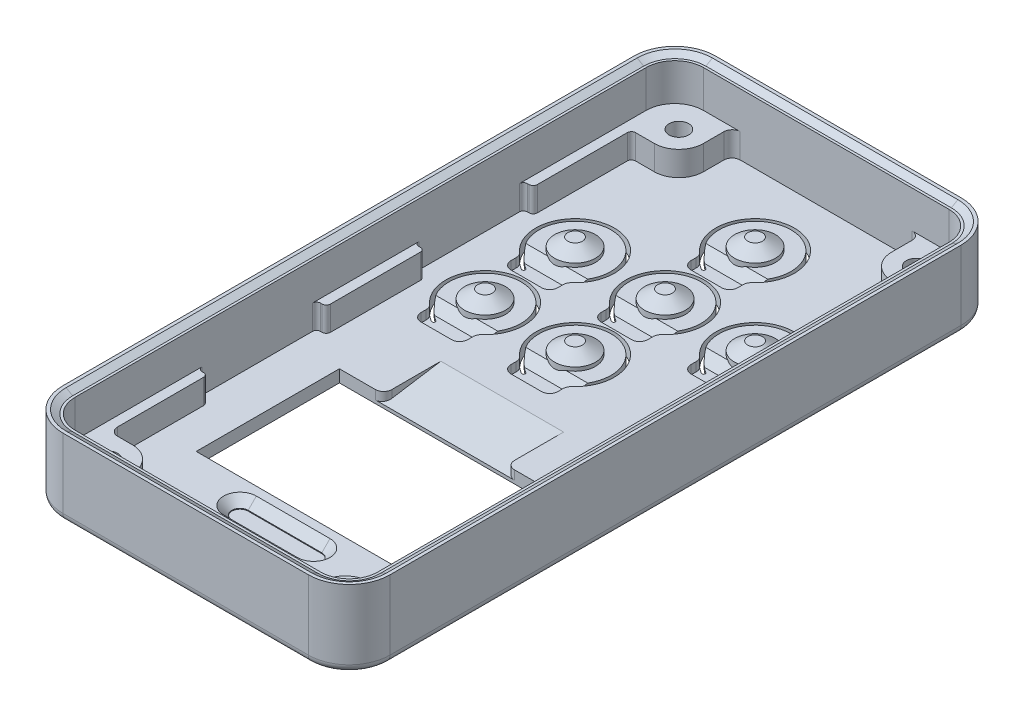
from build123d import *

# Parameters (mm, degrees)
BASE_SKETCH_W                             = 40
BASE_SKETCH_H                             = 79.79
BASE_DEPTH                                = 9.5
CORNER_ROUNDS_R5_R                        = 5
SHELL_1_5_T                               = -1.5
BOSS_SKETCH_R                             = 1
CORNER_BOSSES_STOP_AT_LEDGE_Y4_5_M2_DEPTH = 4.5
LEDGE_SKETCH_W                            = 1.2
LEDGE_SKETCH_H                            = 12
SIDE_LEDGES_DEPTH                         = 4.5
OUTER_FACE_ROUND_R1_R                     = 1
WINDOW_SKETCH_W                           = 25.8
WINDOW_SKETCH_H                           = 17.2
DISPLAY_WINDOW_DEPTH                      = 90.759089233
CABLE_RAMP_DEPTH                          = 7.5
CABLE_RAMP_DEPTH_BACK                     = 7.5
LED_WINDOW_SKETCH_R                       = 1.7
LED_WINDOW_DEPTH                          = 1.1
PLUNGER_STEMS_SKETCH_R                    = 2.5
PLUNGER_STEMS_5_0_DEPTH                   = 0.45
PLUNGER_CONE_SKETCH_R                     = 2.5
PLUNGER_CONES_TO_1_8_DEPTH                = 1
PLUNGER_CONES_TO_1_8_DRAFT                = 57.994616792
PLUNGER_CONES_TO_1_8_PROFILE_2_DEPTH      = 1
PLUNGER_CONES_TO_1_8_PROFILE_2_DRAFT      = 57.994616792
PLUNGER_CONES_TO_1_8_PROFILE_3_DEPTH      = 1
PLUNGER_CONES_TO_1_8_PROFILE_3_DRAFT      = 57.994616792
PLUNGER_CONES_TO_1_8_PROFILE_4_DEPTH      = 1
PLUNGER_CONES_TO_1_8_PROFILE_4_DRAFT      = 57.994616792
PLUNGER_CONES_TO_1_8_PROFILE_5_DEPTH      = 1
PLUNGER_CONES_TO_1_8_PROFILE_5_DRAFT      = 57.994616792
PLUNGER_CONES_TO_1_8_PROFILE_6_DEPTH      = 1
PLUNGER_CONES_TO_1_8_PROFILE_6_DRAFT      = 57.994616792
BOSS_JUNCTION_FILLETS_R1_R                = 1
SKETCH10_W                                = 5.728
SKETCH10_H                                = 2.623
CUT_EXTRUDE7_DEPTH                        = 1.1
BUTTON_C_SLOTS_300DEG_0_4_DEPTH           = 90.759089233
CHAMFER1_SIZE                             = 1.1
FILLET1_R                                 = 1
FILLET2_R                                 = 0.5
FILLET3_R                                 = 1
SKETCH14_R                                = 3.1
SKETCH14_R_2                              = 1.9
BUTTON_SYMBOL_RECESS_0_4_DEPTH            = 0.4
SKETCH15_R                                = 3.1
SKETCH15_R_2                              = 1.9
BUTTON_SYMBOL_INLAYS_0_4_COLOUR_2_DEPTH   = 0.4
BUTTON_SYMBOL_INLAYS_0_4_COLOUR_2_2_DEPTH = 0.4
BUTTON_SYMBOL_INLAYS_0_4_COLOUR_2_3_DEPTH = 0.4
BUTTON_SYMBOL_INLAYS_0_4_COLOUR_2_4_DEPTH = 0.4
BUTTON_SYMBOL_INLAYS_0_4_COLOUR_2_5_DEPTH = 0.4
BUTTON_SYMBOL_INLAYS_0_4_COLOUR_2_6_DEPTH = 0.4
BUTTON_SYMBOL_INLAYS_0_4_COLOUR_2_7_DEPTH = 0.4
SKETCH18_W                                = 25.8
SKETCH18_H                                = 1.5
CUT_EXTRUDE16_DEPTH                       = 0.3
I2C_HEADER_LEAD_POCKET_2_0_0_2_SKIN_DEPTH = 1.1
CHAMFER3_SIZE                             = 1
SKETCH21_R                                = 2.6
SKETCH21_R_2                              = 2.5
CUT_EXTRUDE17_DEPTH                       = 0.1
M2_CLEARANCE_2_4_SCREW_FROM_FRONT_SKET_R  = 1.2
M2_CLEARANCE_2_4_SCREW_FROM_FRONT_DEPTH   = 90.759089233
M2_HEAD_COUNTERBORE_4_4_X_2_0_SKETCH_R    = 2.2
M2_HEAD_COUNTERBORE_4_4_X_2_0_DEPTH       = 2
M2_CSK_SEATS_HEAD_1_MM_BELOW_FACE_SIZE    = 1
WALL_BEVEL_30DEG_0_4_FLATS_DEPTH          = 0.461880215
WALL_BEVEL_30DEG_0_4_FLATS_DRAFT          = -60


# Some blends are built 0.0001 mm under size
with BuildPart() as part:
    # Base Sketch → Base (new body)
    with BuildSketch(Plane(origin=(0, 0, 0), x_dir=(1, 0, 0), z_dir=(0, 1, 0))):
        with Locations((20, 39.895)):
            Rectangle(BASE_SKETCH_W, BASE_SKETCH_H)
    extrude(amount=BASE_DEPTH)

    # Corner Rounds R5
    corner_rounds_r5_edges = [part.edges().sort_by_distance(p)[0] for p in [
        (0, 4.75, -79.79),
        (40, 4.75, -79.79),
        (40, 4.75, 0),
        (0, 4.75, 0),
    ]]
    fillet(corner_rounds_r5_edges, radius=CORNER_ROUNDS_R5_R)

    # Shell 1.5
    shell_1_5_openings = [part.faces().sort_by_distance(p)[0] for p in [
        (20, 9.5, -39.895),
    ]]
    offset(amount=SHELL_1_5_T, openings=shell_1_5_openings, kind=Kind.INTERSECTION)

    # Boss Sketch → Corner Bosses (stop at ledge y4.5) + M2 Holes (add)
    # profile 1 of 4: a face of its own
    with BuildSketch(Plane(origin=(0, 0, 0), x_dir=(1, 0, 0), z_dir=(0, 1, 0))):
        with BuildLine():
            Line((1.5, 1.5), (8.5, 1.5))
            Line((8.5, 1.5), (8.5, 5))
            ThreePointArc((8.5, 5), (7.6213, 7.1213), (5.5, 8))
            Line((5.5, 8), (1.5, 8))
            Line((1.5, 8), (1.5, 1.5))
        make_face()
        with Locations(Location((5.5, 5, 0), (0, 0, 270))):
            Circle(BOSS_SKETCH_R, mode=Mode.SUBTRACT)
    # profile 2 of 4: a face of its own
    with BuildSketch(Plane(origin=(0, 0, 0), x_dir=(1, 0, 0), z_dir=(0, 1, 0))):
        with BuildLine():
            Line((38.5, 1.5), (31.5, 1.5))
            Line((31.5, 1.5), (31.5, 5))
            ThreePointArc((31.5, 5), (32.3787, 7.1213), (34.5, 8))
            Line((34.5, 8), (38.5, 8))
            Line((38.5, 8), (38.5, 1.5))
        make_face()
        with Locations(Location((34.5, 5, 0), (0, 0, 270))):
            Circle(BOSS_SKETCH_R, mode=Mode.SUBTRACT)
    # profile 3 of 4: a face of its own
    with BuildSketch(Plane(origin=(0, 0, 0), x_dir=(1, 0, 0), z_dir=(0, 1, 0))):
        with BuildLine():
            Line((1.5, 78.29), (8.5, 78.29))
            Line((8.5, 78.29), (8.5, 74.79))
            ThreePointArc((8.5, 74.79), (7.6213, 72.6687), (5.5, 71.79))
            Line((5.5, 71.79), (1.5, 71.79))
            Line((1.5, 71.79), (1.5, 78.29))
        make_face()
        with Locations(Location((5.5, 74.79, 0), (0, 0, 270))):
            Circle(BOSS_SKETCH_R, mode=Mode.SUBTRACT)
    # profile 4 of 4: a face of its own
    with BuildSketch(Plane(origin=(0, 0, 0), x_dir=(1, 0, 0), z_dir=(0, 1, 0))):
        with BuildLine():
            Line((38.5, 78.29), (31.5, 78.29))
            Line((31.5, 78.29), (31.5, 74.79))
            ThreePointArc((31.5, 74.79), (32.3787, 72.6687), (34.5, 71.79))
            Line((34.5, 71.79), (38.5, 71.79))
            Line((38.5, 71.79), (38.5, 78.29))
        make_face()
        with Locations(Location((34.5, 74.79, 0), (0, 0, 270))):
            Circle(BOSS_SKETCH_R, mode=Mode.SUBTRACT)
    extrude(amount=CORNER_BOSSES_STOP_AT_LEDGE_Y4_5_M2_DEPTH)

    # Ledge Sketch → Side Ledges (add)
    with BuildSketch(Plane(origin=(0, 0, 0), x_dir=(1, 0, 0), z_dir=(0, 1, 0))):
        with Locations((2.1, 14)):
            Rectangle(LEDGE_SKETCH_W, LEDGE_SKETCH_H)
        with Locations((37.9, 14)):
            Rectangle(LEDGE_SKETCH_W, LEDGE_SKETCH_H)
        with Locations((2.1, 40.5)):
            Rectangle(LEDGE_SKETCH_W, LEDGE_SKETCH_H)
        with Locations((37.9, 40.5)):
            Rectangle(LEDGE_SKETCH_W, LEDGE_SKETCH_H)
        with Locations((2.1, 65.79)):
            Rectangle(LEDGE_SKETCH_W, LEDGE_SKETCH_H)
        with Locations((37.9, 65.79)):
            Rectangle(LEDGE_SKETCH_W, LEDGE_SKETCH_H)
    extrude(amount=SIDE_LEDGES_DEPTH)

    # Outer Face Round R1
    outer_face_round_r1_edges = [part.edges().sort_by_distance(p)[0] for p in [
        (0, 0, -39.895),
        (20, 0, -79.79),
        (40, 0, -39.895),
        (20, 0, 0),
        (1.464466094, 0, -1.464466094),
        (38.535533906, 0, -1.464466094),
        (38.535533906, 0, -78.325533906),
        (1.464466094, 0, -78.325533906),
    ]]
    fillet(outer_face_round_r1_edges, radius=OUTER_FACE_ROUND_R1_R)

    # Window Sketch → Display Window (cut, through all)
    with BuildSketch(Plane(origin=(0, 0, 0), x_dir=(1, 0, 0), z_dir=(0, 1, 0))):
        with Locations((20, 23.1)):
            Rectangle(WINDOW_SKETCH_W, WINDOW_SKETCH_H)
    extrude(amount=DISPLAY_WINDOW_DEPTH, mode=Mode.SUBTRACT)

    # Ramp Sketch → Cable Ramp (cut, two sides: drawn at the far end of the back side and taken through both)
    with BuildSketch(Plane(origin=(20, 0, 0), x_dir=(0, 0, -1), z_dir=(1, 0, 0)).offset(-CABLE_RAMP_DEPTH_BACK)):
        Polygon((31, 0.4), (31.7, 0.4), (38.7, 1.5), (38.7, 2.5), (31, 2.5), align=None)
    extrude(amount=CABLE_RAMP_DEPTH + CABLE_RAMP_DEPTH_BACK, mode=Mode.SUBTRACT)

    # LED Window Sketch → LED Window (cut)
    with BuildSketch(Plane(origin=(0, 1.5, 0), x_dir=(1, 0, 0), z_dir=(0, 1, 0))):
        with Locations(Location((20, 7.28, 0), (0, 0, 270))):
            Circle(LED_WINDOW_SKETCH_R)
    extrude(amount=-LED_WINDOW_DEPTH, mode=Mode.SUBTRACT)

    # Plunger Stems Sketch → Plunger Stems 5.0 (add)
    with BuildSketch(Plane(origin=(0, 1.5, 0), x_dir=(1, 0, 0), z_dir=(0, 1, 0))):
        with Locations(Location((9, 47.6, 0), (0, 0, 270))):
            Circle(PLUNGER_STEMS_SKETCH_R)
        with Locations(Location((20, 47.6, 0), (0, 0, 270))):
            Circle(PLUNGER_STEMS_SKETCH_R)
        with Locations(Location((9, 58.6, 0), (0, 0, 270))):
            Circle(PLUNGER_STEMS_SKETCH_R)
        with Locations(Location((20, 58.6, 0), (0, 0, 270))):
            Circle(PLUNGER_STEMS_SKETCH_R)
        with Locations(Location((31, 58.6, 0), (0, 0, 270))):
            Circle(PLUNGER_STEMS_SKETCH_R)
        with Locations(Location((20, 69.6, 0), (0, 0, 270))):
            Circle(PLUNGER_STEMS_SKETCH_R)
    extrude(amount=PLUNGER_STEMS_5_0_DEPTH)


with BuildPart() as plunger_cones_to_1_8_tool:
    # Plunger Cone Sketch → Plunger Cones to 1.8 (with draft: the straight prism first)
    with BuildSketch(Plane(origin=(0, 1.95, 0), x_dir=(1, 0, 0), z_dir=(0, 1, 0))):
        with Locations(Location((9, 47.6, 0), (0, 0, 270))):
            Circle(PLUNGER_CONE_SKETCH_R)
    extrude(amount=PLUNGER_CONES_TO_1_8_DEPTH)
    # Plunger Cones to 1.8: the draft: its side faces are tilted about the plane it starts from
    plunger_cones_to_1_8_sides = [plunger_cones_to_1_8_tool.faces().sort_by_distance(p)[0] for p in [
        (9, 2.45, -50.1),
    ]]
    draft(plunger_cones_to_1_8_sides, Plane(origin=(0, 1.95, 0), x_dir=(1, 0, 0), z_dir=(0, 1, 0)), PLUNGER_CONES_TO_1_8_DRAFT)


with BuildPart() as part_1:
    add(part.part)

    # Plunger Cones to 1.8: add plunger_cones_to_1_8_tool
    add(plunger_cones_to_1_8_tool.part)


with BuildPart() as plunger_cones_to_1_8_profile_2_tool:
    # Plunger Cone Sketch → Plunger Cones to 1.8 profile 2 (with draft: the straight prism first)
    with BuildSketch(Plane(origin=(0, 1.95, 0), x_dir=(1, 0, 0), z_dir=(0, 1, 0))):
        with Locations(Location((20, 47.6, 0), (0, 0, 270))):
            Circle(PLUNGER_CONE_SKETCH_R)
    extrude(amount=PLUNGER_CONES_TO_1_8_PROFILE_2_DEPTH)
    # Plunger Cones to 1.8 profile 2: the draft: its side faces are tilted about the plane it starts from
    plunger_cones_to_1_8_profile_2_sides = [plunger_cones_to_1_8_profile_2_tool.faces().sort_by_distance(p)[0] for p in [
        (20, 2.45, -50.1),
    ]]
    draft(plunger_cones_to_1_8_profile_2_sides, Plane(origin=(0, 1.95, 0), x_dir=(1, 0, 0), z_dir=(0, 1, 0)), PLUNGER_CONES_TO_1_8_PROFILE_2_DRAFT)


with BuildPart() as part_2:
    add(part_1.part)

    # Plunger Cones to 1.8 profile 2: add plunger_cones_to_1_8_profile_2_tool
    add(plunger_cones_to_1_8_profile_2_tool.part)


with BuildPart() as plunger_cones_to_1_8_profile_3_tool:
    # Plunger Cone Sketch → Plunger Cones to 1.8 profile 3 (with draft: the straight prism first)
    with BuildSketch(Plane(origin=(0, 1.95, 0), x_dir=(1, 0, 0), z_dir=(0, 1, 0))):
        with Locations(Location((9, 58.6, 0), (0, 0, 270))):
            Circle(PLUNGER_CONE_SKETCH_R)
    extrude(amount=PLUNGER_CONES_TO_1_8_PROFILE_3_DEPTH)
    # Plunger Cones to 1.8 profile 3: the draft: its side faces are tilted about the plane it starts from
    plunger_cones_to_1_8_profile_3_sides = [plunger_cones_to_1_8_profile_3_tool.faces().sort_by_distance(p)[0] for p in [
        (9, 2.45, -61.1),
    ]]
    draft(plunger_cones_to_1_8_profile_3_sides, Plane(origin=(0, 1.95, 0), x_dir=(1, 0, 0), z_dir=(0, 1, 0)), PLUNGER_CONES_TO_1_8_PROFILE_3_DRAFT)


with BuildPart() as part_3:
    add(part_2.part)

    # Plunger Cones to 1.8 profile 3: add plunger_cones_to_1_8_profile_3_tool
    add(plunger_cones_to_1_8_profile_3_tool.part)


with BuildPart() as plunger_cones_to_1_8_profile_4_tool:
    # Plunger Cone Sketch → Plunger Cones to 1.8 profile 4 (with draft: the straight prism first)
    with BuildSketch(Plane(origin=(0, 1.95, 0), x_dir=(1, 0, 0), z_dir=(0, 1, 0))):
        with Locations(Location((20, 58.6, 0), (0, 0, 270))):
            Circle(PLUNGER_CONE_SKETCH_R)
    extrude(amount=PLUNGER_CONES_TO_1_8_PROFILE_4_DEPTH)
    # Plunger Cones to 1.8 profile 4: the draft: its side faces are tilted about the plane it starts from
    plunger_cones_to_1_8_profile_4_sides = [plunger_cones_to_1_8_profile_4_tool.faces().sort_by_distance(p)[0] for p in [
        (20, 2.45, -61.1),
    ]]
    draft(plunger_cones_to_1_8_profile_4_sides, Plane(origin=(0, 1.95, 0), x_dir=(1, 0, 0), z_dir=(0, 1, 0)), PLUNGER_CONES_TO_1_8_PROFILE_4_DRAFT)


with BuildPart() as part_4:
    add(part_3.part)

    # Plunger Cones to 1.8 profile 4: add plunger_cones_to_1_8_profile_4_tool
    add(plunger_cones_to_1_8_profile_4_tool.part)


with BuildPart() as plunger_cones_to_1_8_profile_5_tool:
    # Plunger Cone Sketch → Plunger Cones to 1.8 profile 5 (with draft: the straight prism first)
    with BuildSketch(Plane(origin=(0, 1.95, 0), x_dir=(1, 0, 0), z_dir=(0, 1, 0))):
        with Locations(Location((31, 58.6, 0), (0, 0, 270))):
            Circle(PLUNGER_CONE_SKETCH_R)
    extrude(amount=PLUNGER_CONES_TO_1_8_PROFILE_5_DEPTH)
    # Plunger Cones to 1.8 profile 5: the draft: its side faces are tilted about the plane it starts from
    plunger_cones_to_1_8_profile_5_sides = [plunger_cones_to_1_8_profile_5_tool.faces().sort_by_distance(p)[0] for p in [
        (31, 2.45, -61.1),
    ]]
    draft(plunger_cones_to_1_8_profile_5_sides, Plane(origin=(0, 1.95, 0), x_dir=(1, 0, 0), z_dir=(0, 1, 0)), PLUNGER_CONES_TO_1_8_PROFILE_5_DRAFT)


with BuildPart() as part_5:
    add(part_4.part)

    # Plunger Cones to 1.8 profile 5: add plunger_cones_to_1_8_profile_5_tool
    add(plunger_cones_to_1_8_profile_5_tool.part)


with BuildPart() as plunger_cones_to_1_8_profile_6_tool:
    # Plunger Cone Sketch → Plunger Cones to 1.8 profile 6 (with draft: the straight prism first)
    with BuildSketch(Plane(origin=(0, 1.95, 0), x_dir=(1, 0, 0), z_dir=(0, 1, 0))):
        with Locations(Location((20, 69.6, 0), (0, 0, 270))):
            Circle(PLUNGER_CONE_SKETCH_R)
    extrude(amount=PLUNGER_CONES_TO_1_8_PROFILE_6_DEPTH)
    # Plunger Cones to 1.8 profile 6: the draft: its side faces are tilted about the plane it starts from
    plunger_cones_to_1_8_profile_6_sides = [plunger_cones_to_1_8_profile_6_tool.faces().sort_by_distance(p)[0] for p in [
        (20, 2.45, -72.1),
    ]]
    draft(plunger_cones_to_1_8_profile_6_sides, Plane(origin=(0, 1.95, 0), x_dir=(1, 0, 0), z_dir=(0, 1, 0)), PLUNGER_CONES_TO_1_8_PROFILE_6_DRAFT)


with BuildPart() as part_6:
    add(part_5.part)

    # Plunger Cones to 1.8 profile 6: add plunger_cones_to_1_8_profile_6_tool
    add(plunger_cones_to_1_8_profile_6_tool.part)

    # Boss Junction Fillets R1
    boss_junction_fillets_r1_edges = [part_6.edges().sort_by_distance(p)[0] for p in [
        (31.5, 3, -1.5),
        (8.5, 3, -78.29),
        (31.5, 3, -78.29),
        (8.5, 3, -1.5),
        (37.3, 3, -8),
        (37.3, 3, -71.79),
        (2.7, 3, -8),
    ]]
    fillet(boss_junction_fillets_r1_edges, radius=BOSS_JUNCTION_FILLETS_R1_R)

    # Sketch10 → Cut-Extrude7 (cut)
    with BuildSketch(Plane(origin=(0, 1.5, 0), x_dir=(1, 0, 0), z_dir=(0, 1, 0))):
        with Locations((9, 42.9475)):
            Rectangle(SKETCH10_W, SKETCH10_H)
        with Locations((20, 42.9475)):
            Rectangle(SKETCH10_W, SKETCH10_H)
        with Locations((9, 53.9475)):
            Rectangle(SKETCH10_W, SKETCH10_H)
        with Locations((20, 53.9475)):
            Rectangle(SKETCH10_W, SKETCH10_H)
        with Locations((31, 53.9475)):
            Rectangle(SKETCH10_W, SKETCH10_H)
        with Locations((20, 64.9475)):
            Rectangle(SKETCH10_W, SKETCH10_H)
    extrude(amount=-CUT_EXTRUDE7_DEPTH, mode=Mode.SUBTRACT)

    # Sketch11 → Button C-Slots 300deg 0.4 (cut, through all)
    with BuildSketch(Plane(origin=(0, 0, 0), x_dir=(1, 0, 0), z_dir=(0, 1, 0))):
        with BuildLine():
            ThreePointArc((11.4, 43.443078062), (9, 52.4), (6.6, 43.443078062))
            ThreePointArc((6.6, 43.443078062), (6.873205081, 43.516283143), (6.8, 43.789488223))
            ThreePointArc((6.8, 43.789488223), (9, 52), (11.2, 43.789488223))
            ThreePointArc((11.2, 43.789488223), (11.126794919, 43.516283143), (11.4, 43.443078062))
        make_face()
        with BuildLine():
            ThreePointArc((22.4, 43.443078062), (20, 52.4), (17.6, 43.443078062))
            ThreePointArc((17.6, 43.443078062), (17.873205081, 43.516283143), (17.8, 43.789488223))
            ThreePointArc((17.8, 43.789488223), (20, 52), (22.2, 43.789488223))
            ThreePointArc((22.2, 43.789488223), (22.126794919, 43.516283143), (22.4, 43.443078062))
        make_face()
        with BuildLine():
            ThreePointArc((11.4, 54.443078062), (9, 63.4), (6.6, 54.443078062))
            ThreePointArc((6.6, 54.443078062), (6.873205081, 54.516283143), (6.8, 54.789488223))
            ThreePointArc((6.8, 54.789488223), (9, 63), (11.2, 54.789488223))
            ThreePointArc((11.2, 54.789488223), (11.126794919, 54.516283143), (11.4, 54.443078062))
        make_face()
        with BuildLine():
            ThreePointArc((22.4, 54.443078062), (20, 63.4), (17.6, 54.443078062))
            ThreePointArc((17.6, 54.443078062), (17.873205081, 54.516283143), (17.8, 54.789488223))
            ThreePointArc((17.8, 54.789488223), (20, 63), (22.2, 54.789488223))
            ThreePointArc((22.2, 54.789488223), (22.126794919, 54.516283143), (22.4, 54.443078062))
        make_face()
        with BuildLine():
            ThreePointArc((33.4, 54.443078062), (31, 63.4), (28.6, 54.443078062))
            ThreePointArc((28.6, 54.443078062), (28.873205081, 54.516283143), (28.8, 54.789488223))
            ThreePointArc((28.8, 54.789488223), (31, 63), (33.2, 54.789488223))
            ThreePointArc((33.2, 54.789488223), (33.126794919, 54.516283143), (33.4, 54.443078062))
        make_face()
        with BuildLine():
            ThreePointArc((22.4, 65.443078062), (20, 74.4), (17.6, 65.443078062))
            ThreePointArc((17.6, 65.443078062), (17.873205081, 65.516283143), (17.8, 65.789488223))
            ThreePointArc((17.8, 65.789488223), (20, 74), (22.2, 65.789488223))
            ThreePointArc((22.2, 65.789488223), (22.126794919, 65.516283143), (22.4, 65.443078062))
        make_face()
    extrude(amount=BUTTON_C_SLOTS_300DEG_0_4_DEPTH, mode=Mode.SUBTRACT)

    # Chamfer1
    # the kernel refuses this chamfer: 1.1 mm, written as the material it takes off along each edge
    with BuildSketch(Plane(origin=(3.307982808, 1.5, -44.259), x_dir=(0, -0.9996219169112969, 0.02749587661058343), z_dir=(1, 0, 0))) as chamfer1_piece_1_section:
        Polygon((CHAMFER1_SIZE * 0.999621916911, CHAMFER1_SIZE * 0.0274958766106), (-CHAMFER1_SIZE * 0.0274958766106, CHAMFER1_SIZE * 0.999621916911), (0, 0), align=None)
    chamfer1_piece_1 = extrude(amount=11.384034384, mode=Mode.PRIVATE)
    chamfer1_piece_1 = chamfer1_piece_1 & Plane(origin=(9, 1.139629686, -47.6), x_dir=(-0.5000000000000002, 0, 0.8660254037844386), z_dir=(0, -1, 0)) * Cylinder(4.4, 28, mode=Mode.PRIVATE)
    chamfer1_piece_1 = chamfer1_piece_1 - Plane(origin=(9, 1.139629686, -47.6), x_dir=(0, 0, 1), z_dir=(0, -1, 0)) * Cylinder(2.5, 28, mode=Mode.PRIVATE)
    add(chamfer1_piece_1, mode=Mode.SUBTRACT)
    with BuildSketch(Plane(origin=(14.307982808, 1.5, -66.259), x_dir=(0, -0.9996219169112966, 0.0274958766105897), z_dir=(1, 0, 0))) as chamfer1_piece_2_section:
        Polygon((CHAMFER1_SIZE * 0.999621916911, CHAMFER1_SIZE * 0.0274958766106), (-CHAMFER1_SIZE * 0.0274958766106, CHAMFER1_SIZE * 0.999621916911), (0, 0), align=None)
    chamfer1_piece_2 = extrude(amount=11.384034384, mode=Mode.PRIVATE)
    chamfer1_piece_2 = chamfer1_piece_2 & Plane(origin=(20, 1.139629686, -69.6), x_dir=(-0.5000000000000007, 0, 0.8660254037844384), z_dir=(0, -1, 0)) * Cylinder(4.4, 28, mode=Mode.PRIVATE)
    chamfer1_piece_2 = chamfer1_piece_2 - Plane(origin=(20, 1.139629686, -69.6), x_dir=(0, 0, 1), z_dir=(0, -1, 0)) * Cylinder(2.5, 28, mode=Mode.PRIVATE)
    add(chamfer1_piece_2, mode=Mode.SUBTRACT)
    with BuildSketch(Plane(origin=(25.307982808, 1.5, -55.259), x_dir=(0, -0.9996219169112969, 0.02749587661058343), z_dir=(1, 0, 0))) as chamfer1_piece_3_section:
        Polygon((CHAMFER1_SIZE * 0.999621916911, CHAMFER1_SIZE * 0.0274958766106), (-CHAMFER1_SIZE * 0.0274958766106, CHAMFER1_SIZE * 0.999621916911), (0, 0), align=None)
    chamfer1_piece_3 = extrude(amount=11.384034384, mode=Mode.PRIVATE)
    chamfer1_piece_3 = chamfer1_piece_3 & Plane(origin=(31, 1.139629686, -58.6), x_dir=(-0.49999999999999983, 0, 0.8660254037844388), z_dir=(0, -1, 0)) * Cylinder(4.4, 28, mode=Mode.PRIVATE)
    chamfer1_piece_3 = chamfer1_piece_3 - Plane(origin=(31, 1.139629686, -58.6), x_dir=(0, 0, 1), z_dir=(0, -1, 0)) * Cylinder(2.5, 28, mode=Mode.PRIVATE)
    add(chamfer1_piece_3, mode=Mode.SUBTRACT)
    with BuildSketch(Plane(origin=(14.307982808, 1.5, -55.259), x_dir=(0, -0.9996219169112969, 0.02749587661058343), z_dir=(1, 0, 0))) as chamfer1_piece_4_section:
        Polygon((CHAMFER1_SIZE * 0.999621916911, CHAMFER1_SIZE * 0.0274958766106), (-CHAMFER1_SIZE * 0.0274958766106, CHAMFER1_SIZE * 0.999621916911), (0, 0), align=None)
    chamfer1_piece_4 = extrude(amount=11.384034384, mode=Mode.PRIVATE)
    chamfer1_piece_4 = chamfer1_piece_4 & Plane(origin=(20, 1.139629686, -58.6), x_dir=(-0.49999999999999983, 0, 0.8660254037844388), z_dir=(0, -1, 0)) * Cylinder(4.4, 28, mode=Mode.PRIVATE)
    chamfer1_piece_4 = chamfer1_piece_4 - Plane(origin=(20, 1.139629686, -58.6), x_dir=(0, 0, 1), z_dir=(0, -1, 0)) * Cylinder(2.5, 28, mode=Mode.PRIVATE)
    add(chamfer1_piece_4, mode=Mode.SUBTRACT)
    with BuildSketch(Plane(origin=(3.307982808, 1.5, -55.259), x_dir=(0, -0.9996219169112969, 0.02749587661058343), z_dir=(1, 0, 0))) as chamfer1_piece_5_section:
        Polygon((CHAMFER1_SIZE * 0.999621916911, CHAMFER1_SIZE * 0.0274958766106), (-CHAMFER1_SIZE * 0.0274958766106, CHAMFER1_SIZE * 0.999621916911), (0, 0), align=None)
    chamfer1_piece_5 = extrude(amount=11.384034384, mode=Mode.PRIVATE)
    chamfer1_piece_5 = chamfer1_piece_5 & Plane(origin=(9, 1.139629686, -58.6), x_dir=(-0.5000000000000002, 0, 0.8660254037844386), z_dir=(0, -1, 0)) * Cylinder(4.4, 28, mode=Mode.PRIVATE)
    chamfer1_piece_5 = chamfer1_piece_5 - Plane(origin=(9, 1.139629686, -58.6), x_dir=(0, 0, 1), z_dir=(0, -1, 0)) * Cylinder(2.5, 28, mode=Mode.PRIVATE)
    add(chamfer1_piece_5, mode=Mode.SUBTRACT)
    with BuildSketch(Plane(origin=(14.307982808, 1.5, -44.259), x_dir=(0, -0.9996219169112969, 0.02749587661058343), z_dir=(1, 0, 0))) as chamfer1_piece_6_section:
        Polygon((CHAMFER1_SIZE * 0.999621916911, CHAMFER1_SIZE * 0.0274958766106), (-CHAMFER1_SIZE * 0.0274958766106, CHAMFER1_SIZE * 0.999621916911), (0, 0), align=None)
    chamfer1_piece_6 = extrude(amount=11.384034384, mode=Mode.PRIVATE)
    chamfer1_piece_6 = chamfer1_piece_6 & Plane(origin=(20, 1.139629686, -47.6), x_dir=(-0.49999999999999983, 0, 0.8660254037844388), z_dir=(0, -1, 0)) * Cylinder(4.4, 28, mode=Mode.PRIVATE)
    chamfer1_piece_6 = chamfer1_piece_6 - Plane(origin=(20, 1.139629686, -47.6), x_dir=(0, 0, 1), z_dir=(0, -1, 0)) * Cylinder(2.5, 28, mode=Mode.PRIVATE)
    add(chamfer1_piece_6, mode=Mode.SUBTRACT)

    # Fillet1
    fillet1_edges = [part_6.edges().sort_by_distance(p)[0] for p in [
        (22.864, 0.95, -63.636),
        (17.136, 0.95, -63.636),
        (22.864, 0.95, -41.636),
        (17.136, 0.95, -41.636),
        (11.864, 0.95, -52.636),
        (6.136, 0.95, -52.636),
        (22.864, 0.95, -52.636),
        (17.136, 0.95, -52.636),
        (33.864, 0.95, -52.636),
        (28.136, 0.95, -52.636),
        (11.864, 0.95, -41.636),
        (6.136, 0.95, -41.636),
        (22.864, 0.95, -65.748051921),
        (17.136, 0.95, -65.748051921),
        (22.864, 0.95, -43.748051921),
        (17.136, 0.95, -43.748051921),
        (11.864, 0.95, -54.748051921),
        (6.136, 0.95, -54.748051921),
        (22.864, 0.95, -54.748051921),
        (17.136, 0.95, -54.748051921),
        (33.864, 0.95, -54.748051921),
        (28.136, 0.95, -54.748051921),
        (11.864, 0.95, -43.748051921),
        (6.136, 0.95, -43.748051921),
    ]]
    fillet(fillet1_edges, radius=FILLET1_R)

    # Fillet2
    fillet2_edges = [part_6.edges().sort_by_distance(p)[0] for p in [
        (1.5, 3, -59.79),
        (2.7, 3, -59.79),
        (2.7, 3, -71.79),
        (37.3, 3, -46.5),
        (37.3, 3, -34.5),
        (38.5, 3, -34.5),
        (38.5, 3, -46.5),
        (1.5, 3, -46.5),
        (1.5, 3, -34.5),
        (2.7, 3, -34.5),
        (2.7, 3, -46.5),
        (37.3, 3, -20),
        (38.5, 3, -20),
        (37.3, 3, -59.79),
        (38.5, 3, -59.79),
        (1.5, 3, -20),
        (2.7, 3, -20),
    ]]
    fillet(fillet2_edges, radius=FILLET2_R)

    # Fillet3
    fillet3_edges = [part_6.edges().sort_by_distance(p)[0] for p in [
        (12.5, 0.95, -31.7),
        (27.5, 0.95, -31.7),
    ]]
    fillet(fillet3_edges, radius=FILLET3_R)

    # Sketch14 → Button Symbol Recess 0.4 (cut)
    # profile 1 of 7: a face of its own
    with BuildSketch(Plane(origin=(0, 0, 0), x_dir=(1, 0, 0), z_dir=(0, 1, 0))):
        with Locations(Location((20, 58.6, 0), (0, 0, 270))):
            Circle(SKETCH14_R)
        with Locations(Location((20, 58.6, 0), (0, 0, 270))):
            Circle(SKETCH14_R_2, mode=Mode.SUBTRACT)
    # profile 2 of 7: a face of its own
    with BuildSketch(Plane(origin=(0, 0, 0), x_dir=(1, 0, 0), z_dir=(0, 1, 0))):
        with BuildLine():
            Line((8.4, 47), (8.4, 45.2))
            ThreePointArc((8.4, 45.2), (9, 44.6), (9.6, 45.2))
            Line((9.6, 45.2), (9.6, 47))
            ThreePointArc((9.6, 47), (9, 47.6), (8.4, 47))
        make_face()
    # profile 3 of 7: a face of its own
    with BuildSketch(Plane(origin=(0, 0, 0), x_dir=(1, 0, 0), z_dir=(0, 1, 0))):
        with BuildLine():
            Line((20.519615242, 44.9), (22.771281292, 48.8))
            ThreePointArc((22.771281292, 48.8), (22.771281292, 49.4), (22.25166605, 49.7))
            Line((22.25166605, 49.7), (17.74833395, 49.7))
            ThreePointArc((17.74833395, 49.7), (17.228718708, 49.4), (17.228718708, 48.8))
            Line((17.228718708, 48.8), (19.480384758, 44.9))
            ThreePointArc((19.480384758, 44.9), (20, 44.6), (20.519615242, 44.9))
        make_face()
    # profile 4 of 7: a face of its own
    with BuildSketch(Plane(origin=(0, 0, 0), x_dir=(1, 0, 0), z_dir=(0, 1, 0))):
        with BuildLine():
            Line((6.1, 58.080384758), (10, 55.828718708))
            ThreePointArc((10, 55.828718708), (10.6, 55.828718708), (10.9, 56.34833395))
            Line((10.9, 56.34833395), (10.9, 60.85166605))
            ThreePointArc((10.9, 60.85166605), (10.6, 61.371281292), (10, 61.371281292))
            Line((10, 61.371281292), (6.1, 59.119615242))
            ThreePointArc((6.1, 59.119615242), (5.8, 58.6), (6.1, 58.080384758))
        make_face()
    # profile 5 of 7: a face of its own
    with BuildSketch(Plane(origin=(0, 0, 0), x_dir=(1, 0, 0), z_dir=(0, 1, 0))):
        with BuildLine():
            Line((33.9, 59.119615242), (30, 61.371281292))
            ThreePointArc((30, 61.371281292), (29.4, 61.371281292), (29.1, 60.85166605))
            Line((29.1, 60.85166605), (29.1, 56.34833395))
            ThreePointArc((29.1, 56.34833395), (29.4, 55.828718708), (30, 55.828718708))
            Line((30, 55.828718708), (33.9, 58.080384758))
            ThreePointArc((33.9, 58.080384758), (34.2, 58.6), (33.9, 59.119615242))
        make_face()
    # profile 6 of 7: a face of its own
    with BuildSketch(Plane(origin=(0, 0, 0), x_dir=(1, 0, 0), z_dir=(0, 1, 0))):
        with BuildLine():
            Line((19.480384758, 72.5), (17.228718708, 68.6))
            ThreePointArc((17.228718708, 68.6), (17.228718708, 68), (17.74833395, 67.7))
            Line((17.74833395, 67.7), (22.25166605, 67.7))
            ThreePointArc((22.25166605, 67.7), (22.771281292, 68), (22.771281292, 68.6))
            Line((22.771281292, 68.6), (20.519615242, 72.5))
            ThreePointArc((20.519615242, 72.5), (20, 72.8), (19.480384758, 72.5))
        make_face()
    # profile 7 of 7: a face of its own
    with BuildSketch(Plane(origin=(0, 0, 0), x_dir=(1, 0, 0), z_dir=(0, 1, 0))):
        with BuildLine():
            ThreePointArc((11.451342218, 45.543079649), (9, 50.8), (6.548657782, 45.543079649))
            ThreePointArc((6.548657782, 45.543079649), (7.393957014, 45.469125549), (7.467911114, 46.314424781))
            ThreePointArc((7.467911114, 46.314424781), (9, 49.6), (10.532088886, 46.314424781))
            ThreePointArc((10.532088886, 46.314424781), (10.606042986, 45.469125549), (11.451342218, 45.543079649))
        make_face()
    extrude(amount=BUTTON_SYMBOL_RECESS_0_4_DEPTH, mode=Mode.SUBTRACT)

    # Sketch18 → Cut-Extrude16 (cut)
    with BuildSketch(Plane(origin=(0, 0, -14.5), x_dir=(-1, 0, 0), z_dir=(0, 0, -1))):
        with Locations((-20, 0.75)):
            Rectangle(SKETCH18_W, SKETCH18_H)
    extrude(amount=-CUT_EXTRUDE16_DEPTH, mode=Mode.SUBTRACT)

    # Sketch20 → I2C Header Lead Pocket 2.0 (0.2 skin) (cut)
    with BuildSketch(Plane(origin=(0, 1.5, 0), x_dir=(1, 0, 0), z_dir=(0, 1, 0))):
        with BuildLine():
            Line((15.5, 10.15), (24.5, 10.15))
            ThreePointArc((24.5, 10.15), (25.5, 11.15), (24.5, 12.15))
            Line((24.5, 12.15), (15.5, 12.15))
            ThreePointArc((15.5, 12.15), (14.5, 11.15), (15.5, 10.15))
        make_face()
    extrude(amount=-I2C_HEADER_LEAD_POCKET_2_0_0_2_SKIN_DEPTH, mode=Mode.SUBTRACT)

    # Chamfer3
    chamfer3_edges = [part_6.edges().sort_by_distance(p)[0] for p in [
        (14.5, 1.5, -11.15),
        (20, 1.5, -10.15),
        (25.5, 1.5, -11.15),
        (20, 1.5, -12.15),
    ]]
    chamfer(chamfer3_edges, length=CHAMFER3_SIZE)

    # Sketch21 → Cut-Extrude17 (cut)
    with BuildSketch(Plane.XZ):
        with Locations(Location((20, -7.28, 0), (0, 0, 270))):
            Circle(SKETCH21_R)
        with Locations(Location((20, -7.28, 0), (0, 0, 270))):
            Circle(SKETCH21_R_2, mode=Mode.SUBTRACT)
    extrude(amount=-CUT_EXTRUDE17_DEPTH, mode=Mode.SUBTRACT)

    # M2 Clearance 2.4 (screw from front) Sketch → M2 Clearance 2.4 (screw from front) (cut, through all)
    with BuildSketch(Plane(origin=(0, 0, 0), x_dir=(1, 0, 0), z_dir=(0, 1, 0))):
        with Locations(Location((5.5, 5, 0), (0, 0, 270))):
            Circle(M2_CLEARANCE_2_4_SCREW_FROM_FRONT_SKET_R)
        with Locations(Location((34.5, 5, 0), (0, 0, 90))):
            Circle(M2_CLEARANCE_2_4_SCREW_FROM_FRONT_SKET_R)
        with Locations(Location((5.5, 74.79, 0), (0, 0, 90))):
            Circle(M2_CLEARANCE_2_4_SCREW_FROM_FRONT_SKET_R)
        with Locations(Location((34.5, 74.79, 0), (0, 0, 270))):
            Circle(M2_CLEARANCE_2_4_SCREW_FROM_FRONT_SKET_R)
    extrude(amount=M2_CLEARANCE_2_4_SCREW_FROM_FRONT_DEPTH, mode=Mode.SUBTRACT)

    # M2 Head Counterbore 4.4 x 2.0 Sketch → M2 Head Counterbore 4.4 x 2.0 (cut)
    with BuildSketch(Plane(origin=(0, 0, 0), x_dir=(1, 0, 0), z_dir=(0, 1, 0))):
        with Locations(Location((5.5, 5, 0), (0, 0, 270))):
            Circle(M2_HEAD_COUNTERBORE_4_4_X_2_0_SKETCH_R)
        with Locations(Location((34.5, 5, 0), (0, 0, 270))):
            Circle(M2_HEAD_COUNTERBORE_4_4_X_2_0_SKETCH_R)
        with Locations(Location((5.5, 74.79, 0), (0, 0, 270))):
            Circle(M2_HEAD_COUNTERBORE_4_4_X_2_0_SKETCH_R)
        with Locations(Location((34.5, 74.79, 0), (0, 0, 270))):
            Circle(M2_HEAD_COUNTERBORE_4_4_X_2_0_SKETCH_R)
    extrude(amount=M2_HEAD_COUNTERBORE_4_4_X_2_0_DEPTH, mode=Mode.SUBTRACT)

    # M2 CSK Seats (head 1 mm below face)
    m2_csk_seats_head_1_mm_below_face_edges = [part_6.edges().sort_by_distance(p)[0] for p in [
        (34.5, 2, -7.2),
        (5.5, 2, -76.99),
        (34.5, 2, -76.99),
        (5.5, 2, -7.2),
    ]]
    chamfer(m2_csk_seats_head_1_mm_below_face_edges, length=M2_CSK_SEATS_HEAD_1_MM_BELOW_FACE_SIZE - 0.0001)  # a hair under: the kernel refuses the full size


with BuildPart() as body_2:
    # Sketch15 → Button Symbol Inlays 0.4 (colour 2) (new body)
    with BuildSketch(Plane(origin=(0, 0, 0), x_dir=(1, 0, 0), z_dir=(0, 1, 0))):
        with Locations(Location((20, 58.6, 0), (0, 0, 270))):
            Circle(SKETCH15_R)
        with Locations(Location((20, 58.6, 0), (0, 0, 270))):
            Circle(SKETCH15_R_2, mode=Mode.SUBTRACT)
    extrude(amount=BUTTON_SYMBOL_INLAYS_0_4_COLOUR_2_DEPTH)


with BuildPart() as body_3:
    # Sketch15 → Button Symbol Inlays 0.4 _colour 2 2 (new body)
    with BuildSketch(Plane(origin=(0, 0, 0), x_dir=(1, 0, 0), z_dir=(0, 1, 0))):
        with BuildLine():
            Line((8.4, 47), (8.4, 45.2))
            ThreePointArc((8.4, 45.2), (9, 44.6), (9.6, 45.2))
            Line((9.6, 45.2), (9.6, 47))
            ThreePointArc((9.6, 47), (9, 47.6), (8.4, 47))
        make_face()
    extrude(amount=BUTTON_SYMBOL_INLAYS_0_4_COLOUR_2_2_DEPTH)


with BuildPart() as body_4:
    # Sketch15 → Button Symbol Inlays 0.4 _colour 2 3 (new body)
    with BuildSketch(Plane(origin=(0, 0, 0), x_dir=(1, 0, 0), z_dir=(0, 1, 0))):
        with BuildLine():
            Line((20.519615242, 44.9), (22.771281292, 48.8))
            ThreePointArc((22.771281292, 48.8), (22.771281292, 49.4), (22.25166605, 49.7))
            Line((22.25166605, 49.7), (17.74833395, 49.7))
            ThreePointArc((17.74833395, 49.7), (17.228718708, 49.4), (17.228718708, 48.8))
            Line((17.228718708, 48.8), (19.480384758, 44.9))
            ThreePointArc((19.480384758, 44.9), (20, 44.6), (20.519615242, 44.9))
        make_face()
    extrude(amount=BUTTON_SYMBOL_INLAYS_0_4_COLOUR_2_3_DEPTH)


with BuildPart() as body_5:
    # Sketch15 → Button Symbol Inlays 0.4 _colour 2 4 (new body)
    with BuildSketch(Plane(origin=(0, 0, 0), x_dir=(1, 0, 0), z_dir=(0, 1, 0))):
        with BuildLine():
            Line((6.1, 58.080384758), (10, 55.828718708))
            ThreePointArc((10, 55.828718708), (10.6, 55.828718708), (10.9, 56.34833395))
            Line((10.9, 56.34833395), (10.9, 60.85166605))
            ThreePointArc((10.9, 60.85166605), (10.6, 61.371281292), (10, 61.371281292))
            Line((10, 61.371281292), (6.1, 59.119615242))
            ThreePointArc((6.1, 59.119615242), (5.8, 58.6), (6.1, 58.080384758))
        make_face()
    extrude(amount=BUTTON_SYMBOL_INLAYS_0_4_COLOUR_2_4_DEPTH)


with BuildPart() as body_6:
    # Sketch15 → Button Symbol Inlays 0.4 _colour 2 5 (new body)
    with BuildSketch(Plane(origin=(0, 0, 0), x_dir=(1, 0, 0), z_dir=(0, 1, 0))):
        with BuildLine():
            Line((33.9, 59.119615242), (30, 61.371281292))
            ThreePointArc((30, 61.371281292), (29.4, 61.371281292), (29.1, 60.85166605))
            Line((29.1, 60.85166605), (29.1, 56.34833395))
            ThreePointArc((29.1, 56.34833395), (29.4, 55.828718708), (30, 55.828718708))
            Line((30, 55.828718708), (33.9, 58.080384758))
            ThreePointArc((33.9, 58.080384758), (34.2, 58.6), (33.9, 59.119615242))
        make_face()
    extrude(amount=BUTTON_SYMBOL_INLAYS_0_4_COLOUR_2_5_DEPTH)


with BuildPart() as body_7:
    # Sketch15 → Button Symbol Inlays 0.4 _colour 2 6 (new body)
    with BuildSketch(Plane(origin=(0, 0, 0), x_dir=(1, 0, 0), z_dir=(0, 1, 0))):
        with BuildLine():
            Line((19.480384758, 72.5), (17.228718708, 68.6))
            ThreePointArc((17.228718708, 68.6), (17.228718708, 68), (17.74833395, 67.7))
            Line((17.74833395, 67.7), (22.25166605, 67.7))
            ThreePointArc((22.25166605, 67.7), (22.771281292, 68), (22.771281292, 68.6))
            Line((22.771281292, 68.6), (20.519615242, 72.5))
            ThreePointArc((20.519615242, 72.5), (20, 72.8), (19.480384758, 72.5))
        make_face()
    extrude(amount=BUTTON_SYMBOL_INLAYS_0_4_COLOUR_2_6_DEPTH)


with BuildPart() as body_8:
    # Sketch15 → Button Symbol Inlays 0.4 _colour 2 7 (new body)
    with BuildSketch(Plane(origin=(0, 0, 0), x_dir=(1, 0, 0), z_dir=(0, 1, 0))):
        with BuildLine():
            ThreePointArc((11.451342218, 45.543079649), (9, 50.8), (6.548657782, 45.543079649))
            ThreePointArc((6.548657782, 45.543079649), (7.393957014, 45.469125549), (7.467911114, 46.314424781))
            ThreePointArc((7.467911114, 46.314424781), (9, 49.6), (10.532088886, 46.314424781))
            ThreePointArc((10.532088886, 46.314424781), (10.606042986, 45.469125549), (11.451342218, 45.543079649))
        make_face()
    extrude(amount=BUTTON_SYMBOL_INLAYS_0_4_COLOUR_2_7_DEPTH)


with BuildPart() as wall_bevel_30deg_0_4_flats_tool:
    # Wall Bevel 30deg + 0.4 flats Sketch → Wall Bevel 30deg + 0.4 flats (with draft: the straight prism first)
    with BuildSketch(Plane(origin=(0, 9.038119785, 0), x_dir=(1, 0, 0), z_dir=(0, 1, 0))):
        with BuildLine():
            Line((5, 1.2), (35, 1.2))
            ThreePointArc((35, 1.2), (37.687005769, 2.312994231), (38.8, 5))
            Line((38.8, 5), (38.8, 74.79))
            ThreePointArc((38.8, 74.79), (37.687005769, 77.477005769), (35, 78.59))
            Line((35, 78.59), (5, 78.59))
            ThreePointArc((5, 78.59), (2.312994231, 77.477005769), (1.2, 74.79))
            Line((1.2, 74.79), (1.2, 5))
            ThreePointArc((1.2, 5), (2.312994231, 2.312994231), (5, 1.2))
        make_face()
    extrude(amount=WALL_BEVEL_30DEG_0_4_FLATS_DEPTH)
    # Wall Bevel 30deg + 0.4 flats: the draft: its side faces are tilted about the plane it starts from
    wall_bevel_30deg_0_4_flats_sides = [wall_bevel_30deg_0_4_flats_tool.faces().sort_by_distance(p)[0] for p in [
        (1.2, 9.269059892, -39.895),
        (2.312994231, 9.269059892, -2.312994231),
        (20, 9.269059892, -1.2),
        (37.687005769, 9.269059892, -2.312994231),
        (38.8, 9.269059892, -39.895),
        (37.687005769, 9.269059892, -77.477005769),
        (20, 9.269059892, -78.59),
        (2.312994231, 9.269059892, -77.477005769),
    ]]
    draft(wall_bevel_30deg_0_4_flats_sides, Plane(origin=(0, 9.038119785, 0), x_dir=(1, 0, 0), z_dir=(0, 1, 0)), WALL_BEVEL_30DEG_0_4_FLATS_DRAFT)


with BuildPart() as part_7:
    add(part_6.part)

    # Wall Bevel 30deg + 0.4 flats: cut by wall_bevel_30deg_0_4_flats_tool
    add(wall_bevel_30deg_0_4_flats_tool.part, mode=Mode.SUBTRACT)


solid = Compound([body_2.part, body_3.part, body_4.part, body_5.part, body_6.part, body_7.part, body_8.part, part_7.part])
